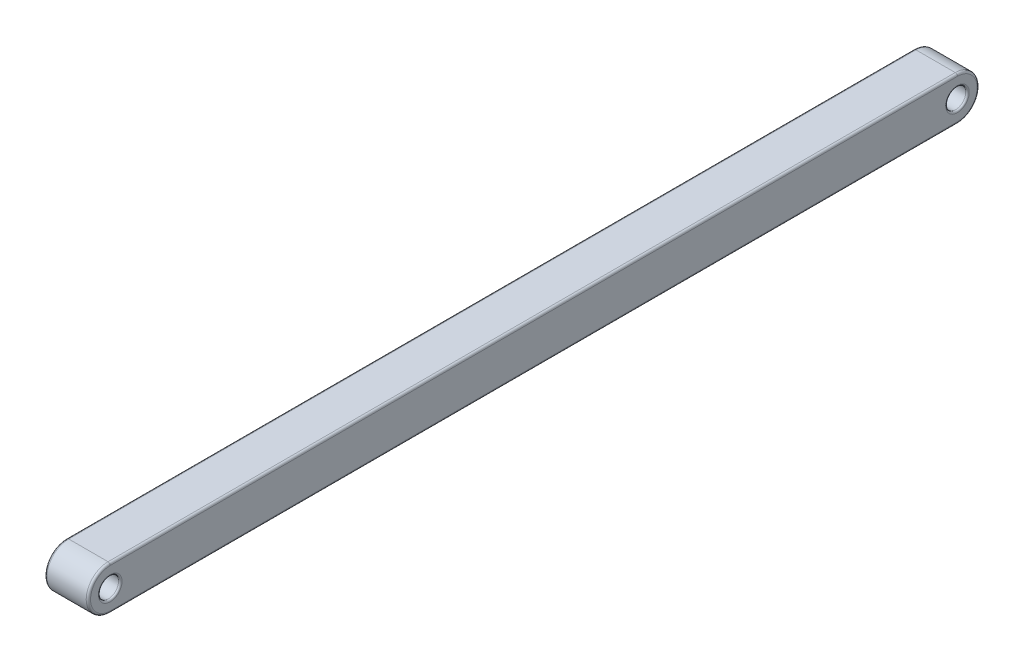
from build123d import *

# Parameters (mm, degrees)
SKETCH1_R           = 0.575
BOSS_EXTRUDE1_DEPTH = 2.5
FILLET1_R           = 0.125
FILLET2_R           = 0.1


with BuildPart() as part:
    # Sketch1 → Boss-Extrude1 (new body)
    with BuildSketch(Plane(origin=(0, 0, 0), x_dir=(0, 0, -1), z_dir=(1, 0, 0))):
        with BuildLine():
            Line((0, 0), (48.5, 0))
            ThreePointArc((48.5, 0), (49.75, -1.25), (48.5, -2.5))
            Line((48.5, -2.5), (0, -2.5))
            ThreePointArc((0, -2.5), (-1.25, -1.25), (0, 0))
        make_face()
        with Locations((0, -1.25)):
            Circle(SKETCH1_R, mode=Mode.SUBTRACT)
        with Locations((48.5, -1.25)):
            Circle(SKETCH1_R, mode=Mode.SUBTRACT)
    extrude(amount=BOSS_EXTRUDE1_DEPTH)

    # Fillet1
    fillet1_edges = [part.edges().sort_by_distance(p)[0] for p in [
        (2.5, -2.5, -24.25),
        (0, -2.5, -24.25),
        (0, 0, -24.25),
        (2.5, 0, -24.25),
        (0, -1.25, -49.75),
        (2.5, -1.25, -49.75),
        (0, -1.25, 1.25),
        (2.5, -1.25, 1.25),
    ]]
    fillet(fillet1_edges, radius=FILLET1_R)

    # Fillet2
    fillet2_edges = [part.edges().sort_by_distance(p)[0] for p in [
        (0, -1.25, 0.575),
        (2.5, -1.25, 0.575),
        (0, -1.25, -47.925),
        (2.5, -1.25, -47.925),
    ]]
    fillet(fillet2_edges, radius=FILLET2_R)


solid = part.part
